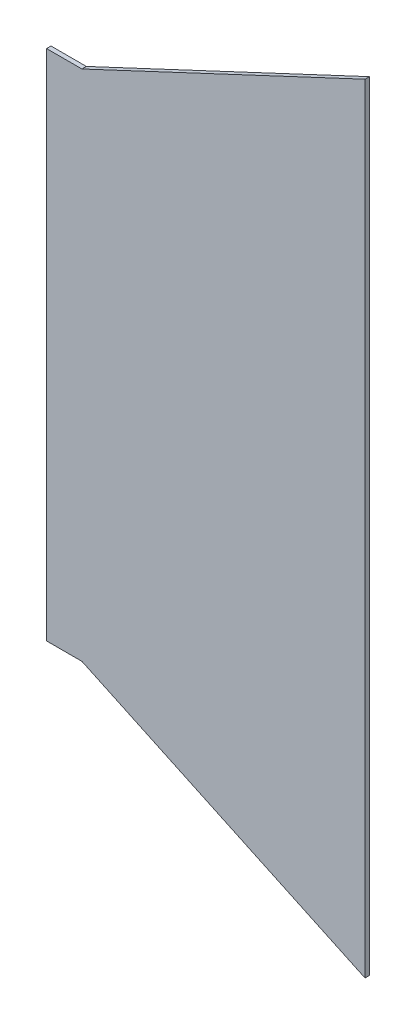
from build123d import *

# Parameters (mm, degrees)
BOSS_EXTRUDE1_DEPTH = 3.175


with BuildPart() as part:
    # Sketch1 → Boss-Extrude1 (new body)
    with BuildSketch(Plane(origin=(0, 0, 0), x_dir=(0, 1, 0), z_dir=(0, 0, 1))):
        Polygon((-368.3, -25.4), (-368.3, 0), (0, 0), (0, -25.4), (95.25, -228.6), (-463.55, -228.6), align=None)
    extrude(amount=BOSS_EXTRUDE1_DEPTH)


solid = part.part
